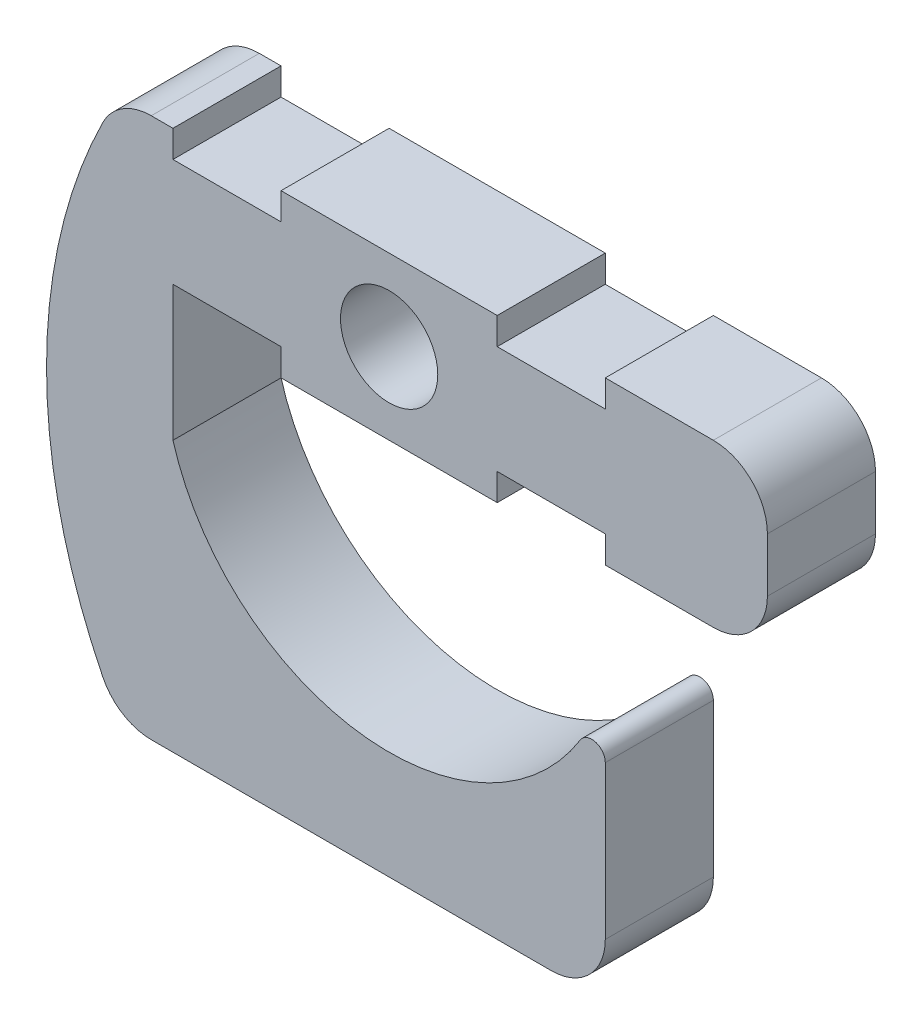
from build123d import *

# Parameters (mm, degrees)
SKETCH1_W              = 30.48
SKETCH1_H              = 7.62
SKETCH1_R              = 2.286
BOSS_EXTRUDE1_DEPTH    = 2.54
FILLET1_R              = 2.54
FILLET2_R              = 5.08
CUT_EXTRUDE1_START     = -5.08
CUT_EXTRUDE1_OUTLINE_W = 5.08
CUT_EXTRUDE1_OUTLINE_H = 1.27
CUT_EXTRUDE1_DEPTH     = 5.08
FILLET3_R              = 0.635


# Read off the part's stored shape, not the designer's step: Cut-Extrude1
with BuildPart() as part:
    # Sketch1 → Boss-Extrude1 (new, symmetric)
    # profile 1 of 7: a face of its own
    with BuildSketch(Plane.XY):
        with Locations((2.54, 0)):
            Rectangle(SKETCH1_W, SKETCH1_H)
        Circle(SKETCH1_R, mode=Mode.SUBTRACT)
    # profile 2 of 7: a face of its own
    with BuildSketch(Plane.XY):
        with BuildLine():
            Line((-12.7, -16.51), (-12.7, -3.81))
            Line((-12.7, -3.81), (-12.7, 3.81))
            ThreePointArc((-12.7, 3.81), (-16.102954744, -8.89), (-12.7, -21.59))
            Line((-12.7, -21.59), (-12.7, -16.51))
        make_face()
    # profile 3 of 7: a face of its own
    with BuildSketch(Plane.XY):
        Polygon((-10.16, -3.81), (-12.7, -3.81), (-12.7, -16.51), (-10.16, -16.51), (-10.16, -8.89), align=None)
    # profile 4 of 7: a face of its own
    with BuildSketch(Plane.XY):
        Polygon((-10.16, -16.51), (-12.7, -16.51), (-12.7, -21.59), (10.16, -21.59), (10.16, -16.51), (9e-09, -16.51), align=None)
    # profile 5 of 7: a face of its own
    with BuildSketch(Plane.XY):
        with BuildLine():
            ThreePointArc((9e-09, -16.51), (-6.349999997, -14.393333336), (-10.16, -8.89))
            Line((-10.16, -8.89), (-10.16, -16.51))
            Line((-10.16, -16.51), (9e-09, -16.51))
        make_face()
    # profile 6 of 7: a face of its own
    with BuildSketch(Plane.XY):
        with BuildLine():
            ThreePointArc((10.16, -8.89), (6.350000003, -14.393333331), (9e-09, -16.51))
            Line((9e-09, -16.51), (10.16, -16.51))
            Line((10.16, -16.51), (10.16, -8.89))
        make_face()
    # profile 7 of 7: a face of its own
    with BuildSketch(Plane.XY):
        with BuildLine():
            ThreePointArc((10.16, -8.89), (6.350000003, -14.393333331), (9e-09, -16.51))
            Line((9e-09, -16.51), (10.16, -16.51))
            Line((10.16, -16.51), (10.16, -8.89))
        make_face()
    extrude(amount=BOSS_EXTRUDE1_DEPTH, both=True)

    # Fillet1
    fillet1_edges = [part.edges().sort_by_distance(p)[0] for p in [
        (10.16, -21.59, 0),
        (-12.7, -21.59, 0),
        (-12.7, 3.81, 0),
        (17.78, 3.81, 0),
        (17.78, -3.81, 0),
    ]]
    fillet(fillet1_edges, radius=FILLET1_R)

    # Fillet2
    fillet2_edges = [part.edges().sort_by_distance(p)[0] for p in [
        (-10.16, -3.81, 0),
    ]]
    fillet(fillet2_edges, radius=FILLET2_R - 0.0001)  # a hair under: the kernel refuses the full size

    # Cut-Extrude1 outline → Cut-Extrude1 (cut)
    with BuildSketch(Plane.XY.offset(2.54).offset(CUT_EXTRUDE1_START)):
        with BuildLine():
            ThreePointArc((-10.16, -8.89), (-8.672102448, -5.297897552), (-5.08, -3.81))
            Line((-5.08, -3.81), (-5.08, -2.54))
            Line((-5.08, -2.54), (-10.16, -2.54))
            Line((-10.16, -2.54), (-10.16, -8.89))
        make_face()
        with Locations((7.62, -3.175)):
            Rectangle(CUT_EXTRUDE1_OUTLINE_W, CUT_EXTRUDE1_OUTLINE_H)
        with Locations((7.62, 3.175)):
            Rectangle(CUT_EXTRUDE1_OUTLINE_W, CUT_EXTRUDE1_OUTLINE_H)
        with Locations((-7.62, 3.175)):
            Rectangle(CUT_EXTRUDE1_OUTLINE_W, CUT_EXTRUDE1_OUTLINE_H)
    extrude(amount=CUT_EXTRUDE1_DEPTH, mode=Mode.SUBTRACT)

    # Fillet3
    fillet3_edges = [part.edges().sort_by_distance(p)[0] for p in [
        (10.16, -8.89, 0),
    ]]
    fillet(fillet3_edges, radius=FILLET3_R)


solid = part.part
